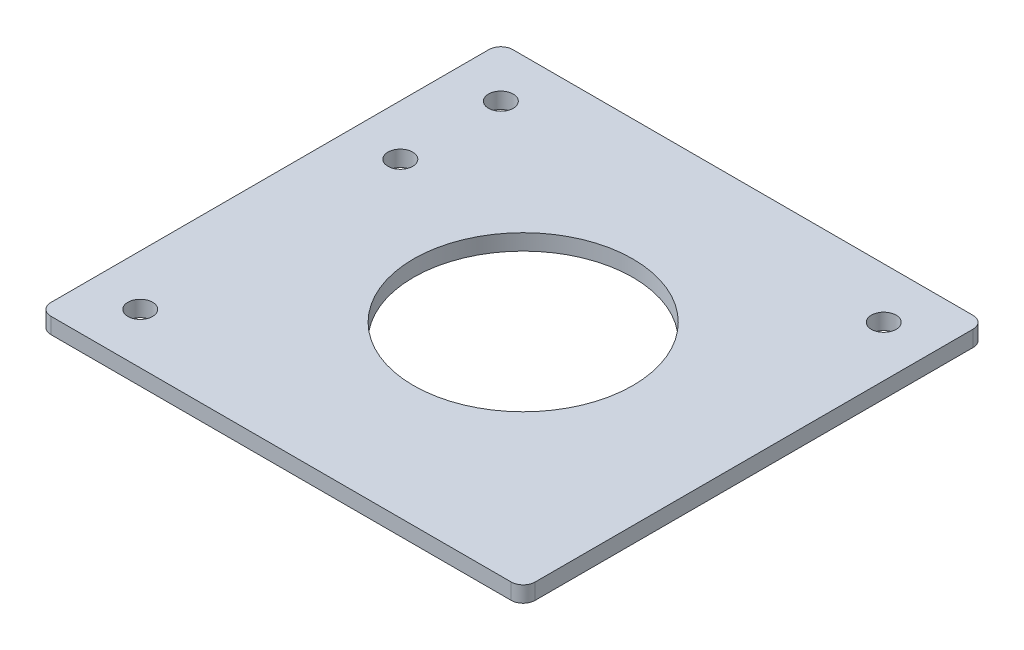
from build123d import *

# Parameters (mm, degrees)
SKETCH1_W           = 121.4
SKETCH1_H           = 115.8
SKETCH1_R           = 27.5
SKETCH1_R_2         = 3.1
BOSS_EXTRUDE1_DEPTH = 4
FILLET1_R           = 3


with BuildPart() as part:
    # Sketch1 → Boss-Extrude1 (new body)
    with BuildSketch(Plane(origin=(0, 0, 0), x_dir=(1, 0, 0), z_dir=(0, 1, 0))):
        with Locations((61.417527055, -57.9)):
            Rectangle(SKETCH1_W, SKETCH1_H)
        with Locations((64.217527055, -57.9)):
            Circle(SKETCH1_R, mode=Mode.SUBTRACT)
        with Locations((13.417527055, -12.7)):
            Circle(SKETCH1_R_2, mode=Mode.SUBTRACT)
        with Locations((109.417527055, -12.7)):
            Circle(SKETCH1_R_2, mode=Mode.SUBTRACT)
        with Locations((13.417527055, -103.1)):
            Circle(SKETCH1_R_2, mode=Mode.SUBTRACT)
        with Locations((13.417527055, -37.9)):
            Circle(SKETCH1_R_2, mode=Mode.SUBTRACT)
    extrude(amount=BOSS_EXTRUDE1_DEPTH)

    # Fillet1
    fillet1_edges = [part.edges().sort_by_distance(p)[0] for p in [
        (122.117527055, 2, 0),
        (122.117527055, 2, 115.8),
        (0.717527055, 2, 115.8),
        (0.717527055, 2, 0),
    ]]
    fillet(fillet1_edges, radius=FILLET1_R)


solid = part.part
